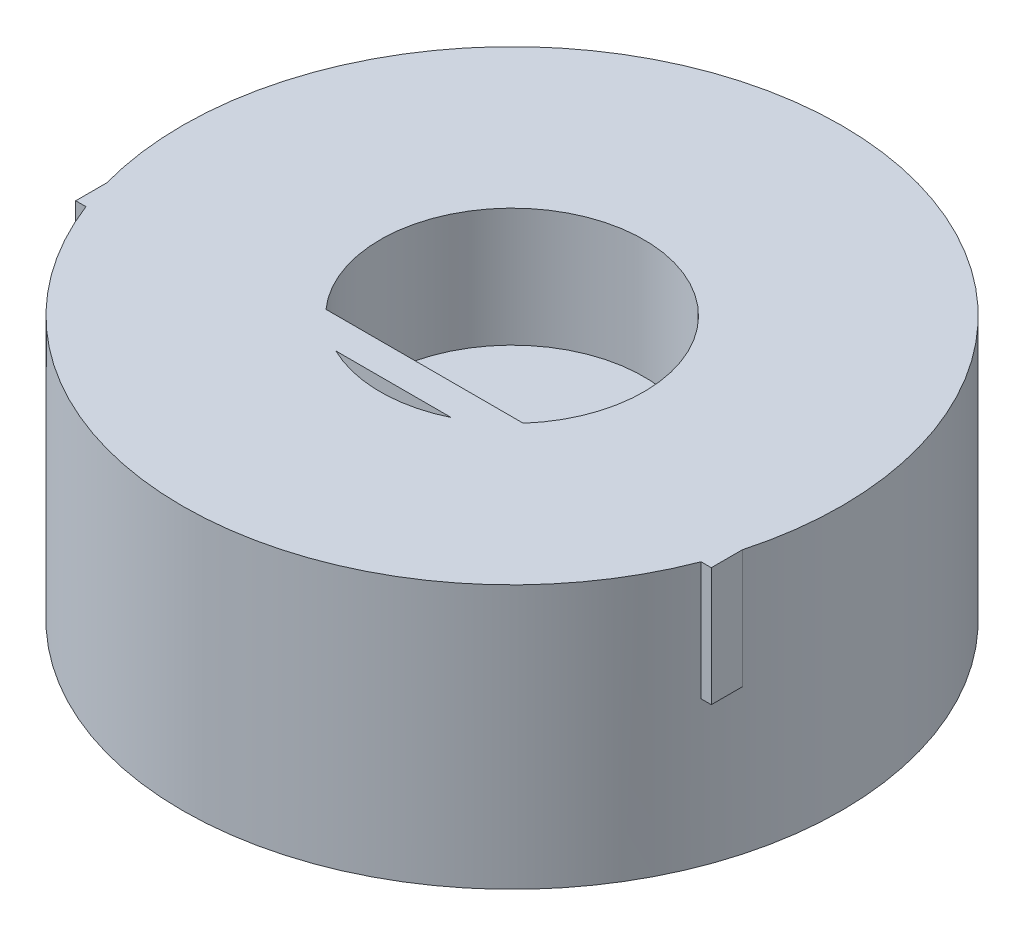
from build123d import *

# Parameters (mm, degrees)
SKETCH1_R           = 25
BOSS_EXTRUDE1_DEPTH = 20
SKETCH2_R           = 10
CUT_EXTRUDE5_DEPTH  = 9
SKETCH9_W           = 48.206046438
SKETCH9_H           = 2.355915038
BOSS_EXTRUDE7_DEPTH = 9


with BuildPart() as part:
    # Sketch1 → Boss-Extrude1 (new body)
    with BuildSketch(Plane(origin=(0, 0, 0), x_dir=(1, 0, 0), z_dir=(0, 1, 0))):
        Circle(SKETCH1_R)
    extrude(amount=BOSS_EXTRUDE1_DEPTH)

    # Sketch2 → Cut-Extrude5 (cut)
    with BuildSketch(Plane(origin=(0, 20, 0), x_dir=(1, 0, 0), z_dir=(0, 1, 0))):
        Circle(SKETCH2_R)
    extrude(amount=-CUT_EXTRUDE5_DEPTH, mode=Mode.SUBTRACT)

    # Sketch9 → Boss-Extrude7 (add)
    with BuildSketch(Plane(origin=(0, 11, 0), x_dir=(1, 0, 0), z_dir=(0, 1, 0))):
        with Locations((0, -7.814543364)):
            Rectangle(SKETCH9_W, SKETCH9_H)
    extrude(amount=BOSS_EXTRUDE7_DEPTH)


solid = part.part
